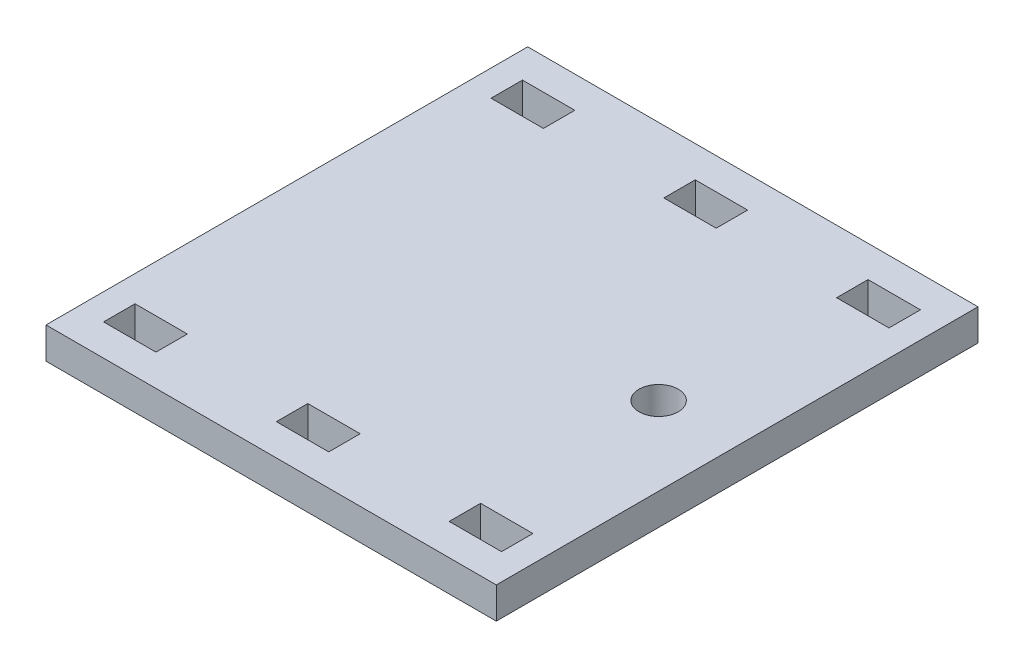
from build123d import *

# Parameters (mm, degrees)
SKETCH1_W                  = 86
SKETCH1_H                  = 92
BOSS_EXTRUDE1_DEPTH        = 6
F_7_5_7_5_DIAMETER_HOLE1_D = 7.5
SKETCH6_W                  = 10
SKETCH6_H                  = 6
CUT_EXTRUDE1_DEPTH         = 149.429417005
SKETCH61_W                 = 10
SKETCH61_H                 = 6
CUT_EXTRUDE11_DEPTH        = 135.363754206
SKETCH62_W                 = 10
SKETCH62_H                 = 6
CUT_EXTRUDE12_DEPTH        = 148.641075367


with BuildPart() as part:
    # Sketch1 → Boss-Extrude1 (new body)
    with BuildSketch(Plane(origin=(0, 0, 0), x_dir=(1, 0, 0), z_dir=(0, 1, 0))):
        with Locations((43, 46)):
            Rectangle(SKETCH1_W, SKETCH1_H)
    extrude(amount=BOSS_EXTRUDE1_DEPTH)

    # Ø7.5 (7.5) Diameter Hole1 (through all)
    with Locations(Plane(origin=(0, 6, 0), x_dir=(1, 0, 0), z_dir=(0, 1, 0))):
        with Locations((71, 46)):
            Hole(F_7_5_7_5_DIAMETER_HOLE1_D / 2)

    # Sketch6 → Cut-Extrude1 (cut, symmetric)
    with BuildSketch(Plane(origin=(9.232221392, 3, 35), x_dir=(1, 0, 0), z_dir=(0, -1, 0))):
        with Locations((0.767778608, -44)):
            Rectangle(SKETCH6_W, SKETCH6_H)
    cut_extrude1 = extrude(amount=CUT_EXTRUDE1_DEPTH, both=True, mode=Mode.SUBTRACT)

    # Sketch61 → Cut-Extrude11 (cut, symmetric)
    with BuildSketch(Plane(origin=(42.232221392, 3, 35), x_dir=(1, 0, 0), z_dir=(0, -1, 0))):
        with Locations((0.767778608, -44)):
            Rectangle(SKETCH61_W, SKETCH61_H)
    cut_extrude11 = extrude(amount=CUT_EXTRUDE11_DEPTH, both=True, mode=Mode.SUBTRACT)

    # Sketch62 → Cut-Extrude12 (cut, symmetric)
    with BuildSketch(Plane(origin=(75.232221392, 3, 35), x_dir=(1, 0, 0), z_dir=(0, -1, 0))):
        with Locations((0.767778608, -44)):
            Rectangle(SKETCH62_W, SKETCH62_H)
    cut_extrude12 = extrude(amount=CUT_EXTRUDE12_DEPTH, both=True, mode=Mode.SUBTRACT)

    # Mirror1: Cut-Extrude1, Cut-Extrude11, Cut-Extrude12 across plane
    add(cut_extrude1.mirror(Plane.XY.offset(-46)), mode=Mode.SUBTRACT)
    add(cut_extrude11.mirror(Plane.XY.offset(-46)), mode=Mode.SUBTRACT)
    add(cut_extrude12.mirror(Plane.XY.offset(-46)), mode=Mode.SUBTRACT)


solid = part.part
